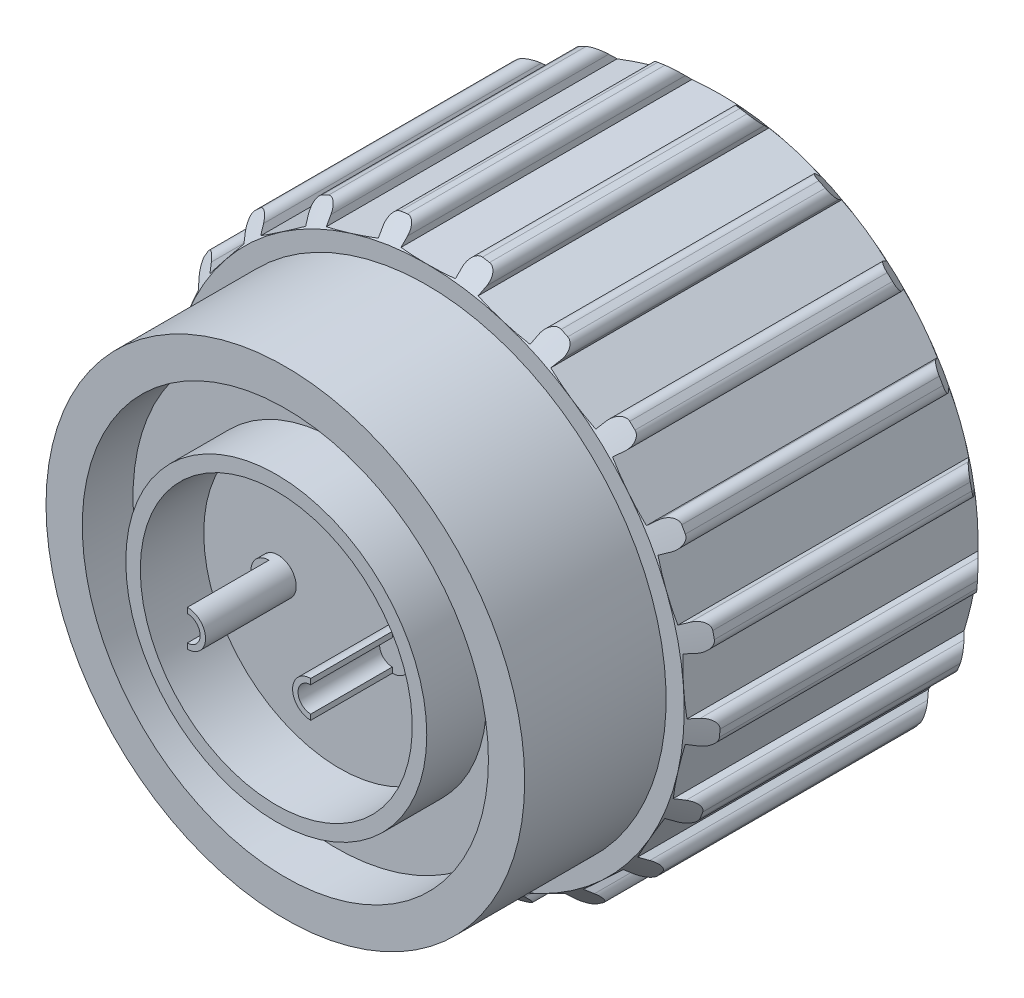
from build123d import *

# Parameters (mm, degrees)
SKETCH1_R                = 13.2
SKETCH1_R_2              = 11.2
EXTRUDE1_DEPTH           = 24
SKETCH2_R                = 15.2
SKETCH2_R_2              = 11.2
EXTRUDE2_DEPTH           = 16.2
SKETCH4_W                = 3
SKETCH4_H                = 1
CUT_EXTRUDE1_DEPTH       = 16.2
FILLET2_R                = 0.5
CIRPATTERN1_COUNT        = 21
FILLET2_OF_CIRPATTERN1_R = 0.5
EXTRUDE3_START           = -0.5
SKETCH5_R                = 8.3
SKETCH5_R_2              = 7.5
EXTRUDE3_DEPTH           = 24
SKETCH6_R                = 13.2
SKETCH6_R_2              = 8
EXTRUDE4_DEPTH           = 5
EXTRUDE5_START           = -0.5
SKETCH7_R                = 7.5
SKETCH7_R_2              = 1
EXTRUDE5_DEPTH           = 20
SKETCH8_R                = 1
EXTRUDE6_DEPTH           = 5
EXTRUDE6_2_DEPTH         = 5
CUT_EXTRUDE2_START       = -4.5
CUT_EXTRUDE2_DEPTH       = 4.5
CUT_EXTRUDE2_2_DEPTH     = 4.5


with BuildPart() as part:
    # Sketch1 → Extrude1 (new body)
    with BuildSketch(Plane.XY):
        Circle(SKETCH1_R)
        Circle(SKETCH1_R_2, mode=Mode.SUBTRACT)
    extrude(amount=EXTRUDE1_DEPTH)

    # Sketch2 → Extrude2 (add)
    with BuildSketch(Plane(origin=(0, 0, 0), x_dir=(-1, 0, 0), z_dir=(0, 0, -1))):
        Circle(SKETCH2_R)
        with Locations(Location((0, 0, 0), (0, 0, 180))):
            Circle(SKETCH2_R_2, mode=Mode.SUBTRACT)
    extrude(amount=-EXTRUDE2_DEPTH)

    # Sketch4 → Cut-Extrude1 (cut)
    with BuildSketch(Plane.XY.offset(16.2)):
        with Locations((0, 14.7)):
            Rectangle(SKETCH4_W, SKETCH4_H)
    cut_extrude1 = extrude(amount=-CUT_EXTRUDE1_DEPTH, mode=Mode.SUBTRACT)

    # Fillet2
    fillet2_edges = [part.edges().sort_by_distance(p)[0] for p in [
        (-1.5, 15.125805764, 8.1),
        (1.5, 15.125805764, 8.1),
    ]]
    fillet(fillet2_edges, radius=FILLET2_R)

    # CirPattern1: Cut-Extrude1 ×21 about axis
    cirpattern1_axis = Axis((0, 0, 0), (0, 0, 1))
    for i in range(1, CIRPATTERN1_COUNT):
        add(cut_extrude1.rotate(cirpattern1_axis, i * 360 / CIRPATTERN1_COUNT), mode=Mode.SUBTRACT)

    # Fillet2 of CirPattern1
    fillet2_of_cirpattern1_edges = [part.edges().sort_by_distance(p)[0] for p in [
        (-5.891768725, 14.011675892, 8.1),
        (-3.025050307, 14.895941415, 8.1),
        (-9.760027943, 11.652547128, 8.1),
        (-7.28131162, 13.342507302, 8.1),
        (-12.761065847, 8.258038415, 8.1),
        (-10.890596441, 10.603532862, 8.1),
        (-14.628227049, 4.129766749, 8.1),
        (-13.532203976, 6.922387995, 8.1),
        (-15.195606083, -0.365452815, 8.1),
        (-14.971415803, 2.626158576, 8.1),
        (-14.412788832, -4.828200294, 8.1),
        (-15.080351634, -1.903416557, 8.1),
        (-12.349332044, -8.861940988, 8.1),
        (-13.849332044, -6.263864776, 8.1),
        (-9.18858291, -12.108259335, 8.1),
        (-11.387738525, -10.067741121, 8.1),
        (-5.21138786, -14.278705704, 8.1),
        (-7.914294464, -12.977054486, 8.1),
        (-0.771138129, -15.18042641, 8.1),
        (-3.737630608, -14.733299611, 8.1),
        (3.737630608, -14.733299611, 8.1),
        (0.771138129, -15.18042641, 8.1),
        (7.914294464, -12.977054486, 8.1),
        (5.21138786, -14.278705704, 8.1),
        (11.387738525, -10.067741121, 8.1),
        (9.18858291, -12.108259335, 8.1),
        (13.849332044, -6.263864776, 8.1),
        (12.349332044, -8.861940988, 8.1),
        (15.080351634, -1.903416557, 8.1),
        (14.412788832, -4.828200294, 8.1),
        (14.971415803, 2.626158576, 8.1),
        (15.195606083, -0.365452815, 8.1),
        (13.532203976, 6.922387995, 8.1),
        (14.628227049, 4.129766749, 8.1),
        (10.890596441, 10.603532862, 8.1),
        (12.761065847, 8.258038415, 8.1),
        (7.28131162, 13.342507302, 8.1),
        (9.760027943, 11.652547128, 8.1),
        (3.025050307, 14.895941415, 8.1),
        (5.891768725, 14.011675892, 8.1),
    ]]
    fillet(fillet2_of_cirpattern1_edges, radius=FILLET2_OF_CIRPATTERN1_R)

    # Chamfer1: read off the stored shape, not the designer's step
    # Chamfer1 outline → Chamfer1 (revolve, cut)
    with BuildSketch(Plane.XZ):
        Polygon((15.200012854, 1.000012854), (14.199999753, -2.47e-07), (15.200012854, -2.47e-07), align=None)
    revolve(axis=Axis((0, 0, 0), (0, 0, 1)), mode=Mode.SUBTRACT)

    # Chamfer2: read off the stored shape, not the designer's step
    # Chamfer2 outline → Chamfer2 (revolve, cut)
    with BuildSketch(Plane.XZ):
        Polygon((15.200012854, 16.200000247), (14.199999753, 16.200000247), (15.200012854, 15.199987146), align=None)
    revolve(axis=Axis((0, 0, 0), (0, 0, 1)), mode=Mode.SUBTRACT)



with BuildPart() as body_2:
    # Sketch5 → Extrude3 (new body)
    with BuildSketch(Plane(origin=(0, 0, 0), x_dir=(-1, 0, 0), z_dir=(0, 0, -1)).offset(EXTRUDE3_START)):
        Circle(SKETCH5_R)
        Circle(SKETCH5_R_2, mode=Mode.SUBTRACT)
    extrude(amount=-EXTRUDE3_DEPTH)


with BuildPart() as part_1:
    add(part.part)

    add(body_2.part)  # Extrude4 merges body 2
    # Sketch6 → Extrude4 (add)
    with BuildSketch(Plane.XY.offset(16.2)):
        with Locations(Location((0, 0, 0), (0, 0, 180))):
            Circle(SKETCH6_R)
        Circle(SKETCH6_R_2, mode=Mode.SUBTRACT)
    extrude(amount=EXTRUDE4_DEPTH)

    # Sketch7 → Extrude5 (add)
    with BuildSketch(Plane(origin=(0, 0, 0.5), x_dir=(-1, 0, 0), z_dir=(0, 0, -1)).offset(EXTRUDE5_START)):
        Circle(SKETCH7_R)
        with Locations((3.4, 0)):
            Circle(SKETCH7_R_2, mode=Mode.SUBTRACT)
        with Locations(Location((-3.4, 0, 0), (0, 0, 180))):
            Circle(SKETCH7_R_2, mode=Mode.SUBTRACT)
    extrude(amount=-EXTRUDE5_DEPTH)


with BuildPart() as body_2_2:
    # Sketch8 → Extrude6 (new body)
    with BuildSketch(Plane.XY.offset(21)):
        with Locations((-3.4, 0)):
            Circle(SKETCH8_R)
    extrude(amount=EXTRUDE6_DEPTH)

    # Cut-Extrude2 2 outline → Cut-Extrude2 2 (cut)
    with BuildSketch(Plane.XY.offset(26).offset(CUT_EXTRUDE2_START)):
        with BuildLine():
            Line((-3.4, -1), (-3.4, -0.7))
            ThreePointArc((-3.4, -0.7), (-2.7, 0), (-3.4, 0.7))
            Line((-3.4, 0.7), (-3.4, 1))
            ThreePointArc((-3.4, 1), (-4.4, 0), (-3.4, -1))
        make_face()
    extrude(amount=CUT_EXTRUDE2_2_DEPTH, mode=Mode.SUBTRACT)


with BuildPart() as body_3:
    # Sketch8 → Extrude6 2 (new body)
    with BuildSketch(Plane.XY.offset(21)):
        with Locations((3.4, 0)):
            Circle(SKETCH8_R)
    extrude(amount=EXTRUDE6_2_DEPTH)

    # Cut-Extrude2: read off the stored shape, not the designer's step
    # Cut-Extrude2 outline → Cut-Extrude2 (cut)
    with BuildSketch(Plane.XY.offset(26).offset(CUT_EXTRUDE2_START)):
        with BuildLine():
            Line((3.4, 1), (3.4, 0.7))
            ThreePointArc((3.4, 0.7), (2.7, 0), (3.4, -0.7))
            Line((3.4, -0.7), (3.4, -1))
            ThreePointArc((3.4, -1), (4.4, 0), (3.4, 1))
        make_face()
    extrude(amount=CUT_EXTRUDE2_DEPTH, mode=Mode.SUBTRACT)


solid = Compound([part_1.part, body_2_2.part, body_3.part])
